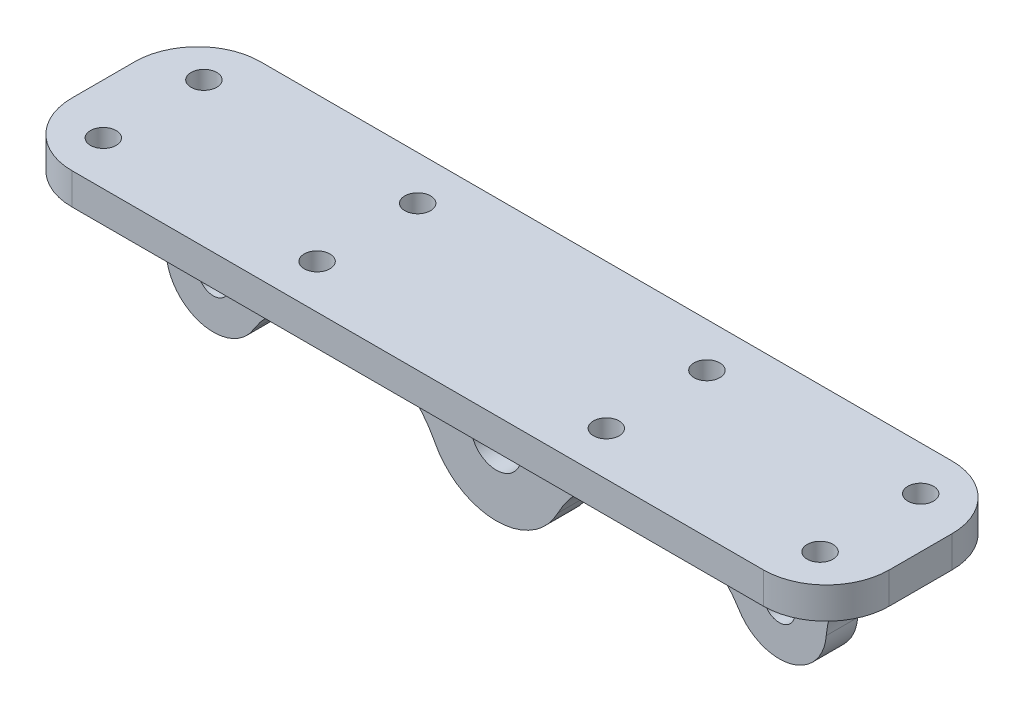
from build123d import *
from build123d.topology import SkipClean

# Parameters (mm, degrees)
SKETCH1_R                                = 2.5
BOSS_EXTRUDE1_DEPTH                      = 2.5
SKETCH4_W                                = 130
SKETCH4_H                                = 30
BOSS_EXTRUDE2_DEPTH                      = 5
FILLET1_R                                = 10
FILLET2_R                                = 12.5
SKETCH5_R                                = 2.05
CUT_EXTRUDE1_DEPTH                       = 10
BOSS_EXTRUDE3_DEPTH                      = 2.5
LPATTERN1_COUNT                          = 2
LPATTERN1_PITCH                          = 23
MIRROR4_COPY_1_DEPTH                     = 2.5
MIRROR4_AT_THE_SECOND_PLANE_COPY_1_DEPTH = 2.5
MIRROR4_AT_THE_SECOND_PLANE_COPY_2_DEPTH = 2.5
MIRROR4_AT_THE_SECOND_PLANE_COPY_3_DEPTH = 2.5


with BuildPart() as part:
    # Sketch1 → Boss-Extrude1 (new, symmetric)
    with BuildSketch(Plane.XY):
        with BuildLine():
            ThreePointArc((-38.614160498, -3.933326056), (-23.874667518, 3.933250754), (-9.779272654, -5.036449778))
            ThreePointArc((-9.779272654, -5.036449778), (-5.727087063, -9.391510729), (0, -11))
            Line((0, -11), (0, -4))
            ThreePointArc((0, -4), (-4, 0), (0, 4))
            Line((0, 4), (0, 11))
            Line((0, 11), (-52.5, 11))
            Line((-52.5, 11), (-52.5, 0))
            ThreePointArc((-52.5, 0), (-47.044040574, -7.216086067), (-38.614160498, -3.933326056))
        make_face()
        with Locations((-45, 0)):
            Circle(SKETCH1_R, mode=Mode.SUBTRACT)
    boss_extrude1 = extrude(amount=BOSS_EXTRUDE1_DEPTH, both=True)

    # Mirror1: Boss-Extrude1 across plane
    with SkipClean():  # the faces are left unmerged after this step: merging them gives an invalid solid
        add(boss_extrude1.mirror(Plane(origin=(0, 0, -2.5), x_dir=(0, 0, 1), z_dir=(-1, 0, 0))))

    # Sketch4 → Boss-Extrude2 (add)
    with SkipClean():  # the faces are left unmerged after this step: merging them gives an invalid solid
        with BuildSketch(Plane(origin=(0, 11, 0), x_dir=(1, 0, 0), z_dir=(0, 1, 0))):
            Rectangle(SKETCH4_W, SKETCH4_H)
        extrude(amount=BOSS_EXTRUDE2_DEPTH)

    # Fillet1
    fillet1_edges = [part.edges().sort_by_distance(p)[0] for p in [
        (-65, 13.5, -15),
        (-65, 13.5, 15),
        (65, 13.5, 15),
        (65, 13.5, -15),
    ]]
    fillet(fillet1_edges, radius=FILLET1_R)

    # Fillet2
    # the kernel refuses this fillet: 12.5 mm, written as the material it adds along each edge
    with BuildSketch(Plane(origin=(-52.5, 11, -2.5), x_dir=(-1, 0, 0), z_dir=(0, 0, 1))) as fillet2_piece_1:
        with BuildLine():
            CenterArc((12.443670675, 12.5), FILLET2_R, 184.301222305, 85.698777695)
            Line((-0.021123497, 11.5625), (-1.267602914, 11.46875))
            ThreePointArc((-1.267602914, 11.46875), (-1.25, 11), (-1.25, 0))
            Line((-1.25, 0), (0, -1.25))
            Line((0, -1.25), (12.443670675, -1.25))
            Line((12.443670675, -1.25), (12.443670675, 0))
        make_face()
    extrude(amount=5)
    with BuildSketch(Plane(origin=(52.5, 11, -2.5), x_dir=(1, 0, 0), z_dir=(0, 0, 1))) as fillet2_piece_2:
        with BuildLine():
            CenterArc((12.443670675, -12.5), FILLET2_R, 90, 85.698777695)
            Line((-0.021123497, -11.5625), (-1.267602914, -11.46875))
            ThreePointArc((-1.267602914, -11.46875), (-1.25, -11), (-1.25, 0))
            Line((-1.25, 0), (0, 1.25))
            Line((0, 1.25), (12.443670675, 1.25))
            Line((12.443670675, 1.25), (12.443670675, 0))
        make_face()
    extrude(amount=5)

    # Sketch5 → Cut-Extrude1 (cut)
    with BuildSketch(Plane(origin=(0, 16, 0), x_dir=(1, 0, 0), z_dir=(0, 1, 0))):
        with Locations(Location((-57, -8, 0), (0, 0, 180))):
            Circle(SKETCH5_R)
        with Locations(Location((-57, 8, 0), (0, 0, 180))):
            Circle(SKETCH5_R)
        with Locations(Location((-23, -8, 0), (0, 0, 180))):
            Circle(SKETCH5_R)
        with Locations(Location((-23, 8, 0), (0, 0, 180))):
            Circle(SKETCH5_R)
    cut_extrude1 = extrude(amount=-CUT_EXTRUDE1_DEPTH, mode=Mode.SUBTRACT)

    # Mirror2: Cut-Extrude1 across plane
    add(cut_extrude1.mirror(Plane(origin=(0, 0, 0), x_dir=(0, 0, 1), z_dir=(1, 0, 0))), mode=Mode.SUBTRACT)

    # Sketch7 → Boss-Extrude3 (add, symmetric)
    with BuildSketch(Plane(origin=(36.5, 0, 0), x_dir=(0, 0, -1), z_dir=(1, 0, 0))):
        Polygon((5, 11), (2.5, 11), (2.5, 6), (7.5, 11), align=None)
    boss_extrude3 = extrude(amount=BOSS_EXTRUDE3_DEPTH, both=True)

    # LPattern1: Boss-Extrude3 ×2
    with Locations(*[(-i * LPATTERN1_PITCH, 0, 0) for i in range(1, LPATTERN1_COUNT)]):
        add(boss_extrude3)

    # Mirror4: Boss-Extrude3 across plane
    add(boss_extrude3.mirror(Plane.XY))

    # Mirror4 copy 1 sketch → Mirror4 copy 1 (add, symmetric)
    with BuildSketch(Plane(origin=(13.5, 0, 0), x_dir=(0, 0, 1), z_dir=(1, 0, 0))):
        Polygon((5, -11), (2.5, -11), (2.5, -6), (7.5, -11), align=None)
    extrude(amount=MIRROR4_COPY_1_DEPTH, both=True)

    # Mirror4 at the second plane: Boss-Extrude3 across plane
    add(boss_extrude3.mirror(Plane(origin=(0, 0, 0), x_dir=(0, 0, 1), z_dir=(1, 0, 0))))

    # Mirror4 at the second plane copy 1 sketc → Mirror4 at the second plane copy 1 (add, symmetric)
    with BuildSketch(Plane(origin=(-13.5, 0, 0), x_dir=(0, 0, -1), z_dir=(-1, 0, 0))):
        Polygon((5, -11), (2.5, -11), (2.5, -6), (7.5, -11), align=None)
    extrude(amount=MIRROR4_AT_THE_SECOND_PLANE_COPY_1_DEPTH, both=True)

    # Mirror4 at the second plane copy 2 sketc → Mirror4 at the second plane copy 2 (add, symmetric)
    with BuildSketch(Plane.ZY.offset(36.5)):
        Polygon((5, 11), (2.5, 11), (2.5, 6), (7.5, 11), align=None)
    extrude(amount=MIRROR4_AT_THE_SECOND_PLANE_COPY_2_DEPTH, both=True)

    # Mirror4 at the second plane copy 3 sketc → Mirror4 at the second plane copy 3 (add, symmetric)
    with BuildSketch(Plane.ZY.offset(13.5)):
        Polygon((5, 11), (2.5, 11), (2.5, 6), (7.5, 11), align=None)
    extrude(amount=MIRROR4_AT_THE_SECOND_PLANE_COPY_3_DEPTH, both=True)


solid = part.part
